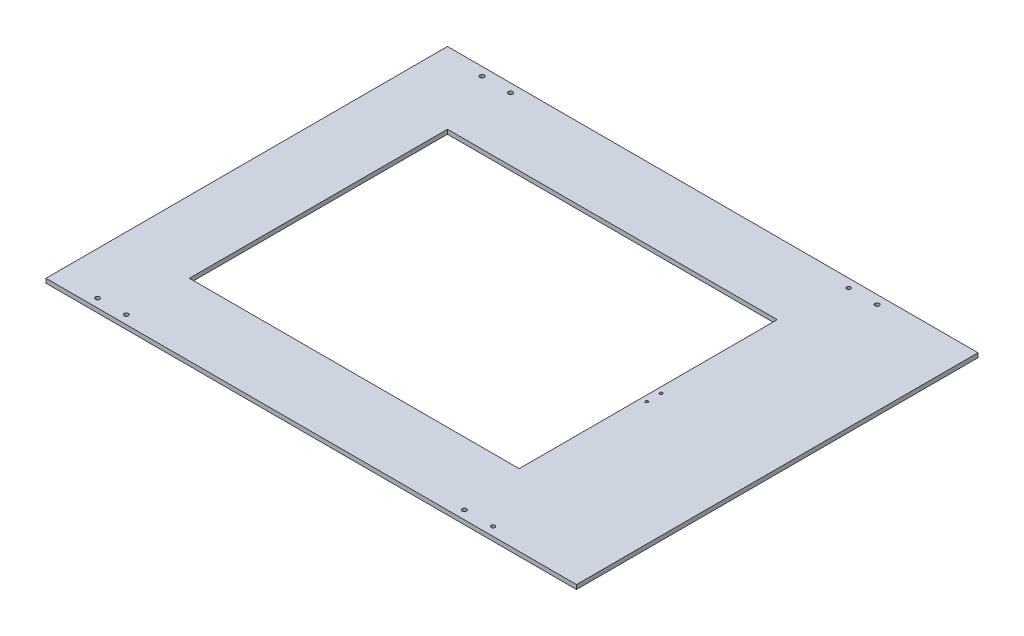
from build123d import *

# Parameters (mm, degrees)
SKETCH1_W           = 370
SKETCH1_H           = 280
SKETCH1_R           = 1.5
SKETCH1_R_2         = 1.569181713
SKETCH1_R_3         = 1.357318829
SKETCH1_R_4         = 1.322467774
SKETCH1_R_5         = 1
SKETCH1_W_2         = 230
SKETCH1_H_2         = 180
BOSS_EXTRUDE1_DEPTH = 3


with BuildPart() as part:
    # Sketch1 → Boss-Extrude1 (new body)
    with BuildSketch(Plane(origin=(0, 0, 0), x_dir=(1, 0, 0), z_dir=(0, 1, 0))):
        with Locations((185, 140)):
            Rectangle(SKETCH1_W, SKETCH1_H)
        with Locations((30, 274)):
            Circle(SKETCH1_R, mode=Mode.SUBTRACT)
        with Locations((50, 274)):
            Circle(SKETCH1_R_2, mode=Mode.SUBTRACT)
        with Locations((30, 6)):
            Circle(SKETCH1_R, mode=Mode.SUBTRACT)
        with Locations((50, 6)):
            Circle(SKETCH1_R, mode=Mode.SUBTRACT)
        with Locations((285.756924446, 273.985388104)):
            Circle(SKETCH1_R_3, mode=Mode.SUBTRACT)
        with Locations((305.756860025, 273.934625414)):
            Circle(SKETCH1_R, mode=Mode.SUBTRACT)
        with Locations((285.756860726, 6.001523901)):
            Circle(SKETCH1_R, mode=Mode.SUBTRACT)
        with Locations((305.756860025, 6.006818111)):
            Circle(SKETCH1_R_4, mode=Mode.SUBTRACT)
        with Locations((284, 145)):
            Circle(SKETCH1_R_5, mode=Mode.SUBTRACT)
        with Locations((284, 135)):
            Circle(SKETCH1_R_5, mode=Mode.SUBTRACT)
        with Locations((165, 140)):
            Rectangle(SKETCH1_W_2, SKETCH1_H_2, mode=Mode.SUBTRACT)
    extrude(amount=BOSS_EXTRUDE1_DEPTH)


solid = part.part
